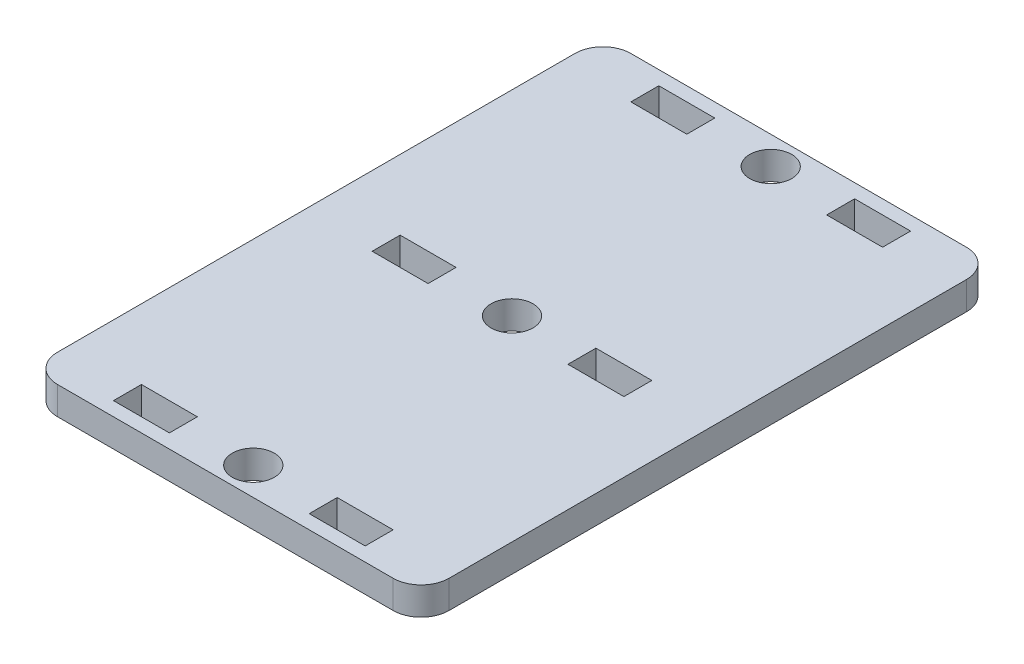
from build123d import *

# Parameters (mm, degrees)
SKETCH1_R           = 2.25
BOSS_EXTRUDE1_DEPTH = 2
FILLET1_R           = 10.25
FILLET2_R           = 2
SKETCH2_R           = 1.5
SKETCH2_W           = 4
SKETCH2_H           = 2
CUT_EXTRUDE1_DEPTH  = 2
FILLET3_R           = 8
SKETCH3_W           = 40.842978794
SKETCH3_H           = 39.737994682
CUT_EXTRUDE2_DEPTH  = 2


with BuildPart() as part:
    # Sketch1 → Boss-Extrude1 (new body)
    with BuildSketch(Plane(origin=(0, 0, 0), x_dir=(1, 0, 0), z_dir=(0, 1, 0))):
        Polygon((0, 0), (37.5, 0), (37.5, -10.25), (65.5, -10.25), (65.5, -0.75), (65.5, 21.25), (65.5, 30.75), (37.5, 30.75), (37.5, 20.5), (0, 20.5), align=None)
        with Locations(Location((10.25, 10.25, 0), (0, 0, 270))):
            Circle(SKETCH1_R, mode=Mode.SUBTRACT)
    extrude(amount=BOSS_EXTRUDE1_DEPTH)

    # Fillet1
    fillet1_edges = [part.edges().sort_by_distance(p)[0] for p in [
        (0, 1, -20.5),
        (0, 1, 0),
    ]]
    fillet(fillet1_edges, radius=FILLET1_R - 0.0001)  # a hair under: the kernel refuses the full size

    # Fillet2
    fillet2_edges = [part.edges().sort_by_distance(p)[0] for p in [
        (37.5, 1, -30.75),
        (65.5, 1, -30.75),
        (65.5, 1, 10.25),
        (37.5, 1, 10.25),
    ]]
    fillet(fillet2_edges, radius=FILLET2_R)

    # Sketch2 → Cut-Extrude1 (cut)
    with BuildSketch(Plane(origin=(0, 2, 0), x_dir=(1, 0, 0), z_dir=(0, 1, 0))):
        with Locations(Location((51.5, 28.75, 0), (0, 0, 270))):
            Circle(SKETCH2_R)
        with Locations(Location((51.5, 10.25, 0), (0, 0, 270))):
            Circle(SKETCH2_R)
        with Locations(Location((51.5, -8.25, 0), (0, 0, 270))):
            Circle(SKETCH2_R)
        with Locations((44.5, 28.75)):
            Rectangle(SKETCH2_W, SKETCH2_H)
        with Locations((58.5, 28.75)):
            Rectangle(SKETCH2_W, SKETCH2_H)
        with Locations((44.5, 10.25)):
            Rectangle(SKETCH2_W, SKETCH2_H)
        with Locations((58.5, 10.25)):
            Rectangle(SKETCH2_W, SKETCH2_H)
        with Locations((44.5, -8.25)):
            Rectangle(SKETCH2_W, SKETCH2_H)
        with Locations((58.5, -8.25)):
            Rectangle(SKETCH2_W, SKETCH2_H)
    extrude(amount=-CUT_EXTRUDE1_DEPTH, mode=Mode.SUBTRACT)

    # Fillet3
    fillet3_edges = [part.edges().sort_by_distance(p)[0] for p in [
        (37.5, 1, -20.5),
        (37.5, 1, 0),
    ]]
    fillet(fillet3_edges, radius=FILLET3_R)

    # Sketch3 → Cut-Extrude2 (cut)
    with BuildSketch(Plane(origin=(0, 2, 0), x_dir=(1, 0, 0), z_dir=(0, 1, 0))):
        with Locations((17.078510603, 8.881002659)):
            Rectangle(SKETCH3_W, SKETCH3_H)
    extrude(amount=-CUT_EXTRUDE2_DEPTH, mode=Mode.SUBTRACT)


solid = part.part
